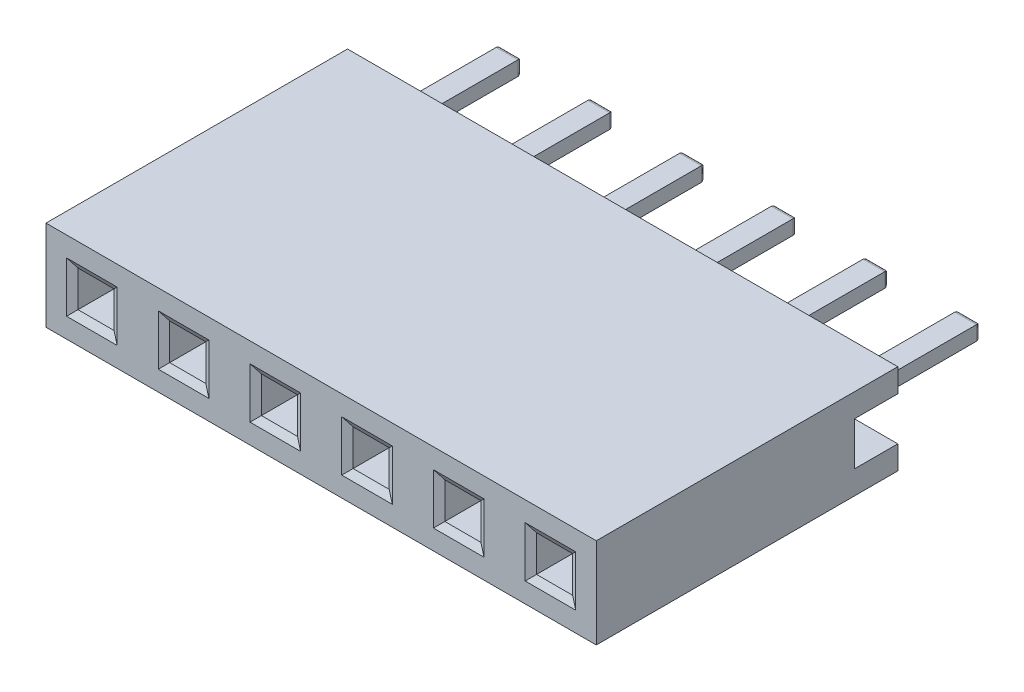
from build123d import *

# Parameters (mm, degrees)
SKETCH1_W                   = 2.54
SKETCH1_H                   = 2.5
SKETCH1_W_2                 = 1
SKETCH1_H_2                 = 1
BOSS_EXTRUDE1_DEPTH         = 8.35
CHAMFER1_SIZE               = 0.2
CHAMFER1_SIZE2              = 0.115470054
LPATTERN2_COUNT             = 6
LPATTERN2_PITCH             = 2.54
CHAMFER1_OF_LPATTERN2_SIZE2 = 0.115470054
CHAMFER1_OF_LPATTERN2_SIZE  = 0.2
SKETCH4_W                   = 1.2
SKETCH4_H                   = 1.2
CUT_EXTRUDE1_DEPTH          = 18.422473992
SKETCH3_W                   = 0.7
SKETCH3_H                   = 0.4
SKETCH3_W_2                 = 0.6
BOSS_EXTRUDE2_DEPTH         = 0.2
SKETCH3_3_W                 = 0.6
SKETCH3_3_H                 = 0.4
BOSS_EXTRUDE3_DEPTH         = 4.45
FILLET1_R                   = 0.1
FILLET2_R                   = 0.25
LPATTERN3_START             = -0.2
LPATTERN3_DEPTH             = 0.4
LPATTERN3_START_2           = -1
LPATTERN3_2_DEPTH           = 12


with BuildPart() as part:
    # Sketch1 → Boss-Extrude1 (new body)
    with BuildSketch(Plane.XY):
        with Locations((0.02, 0)):
            Rectangle(SKETCH1_W, SKETCH1_H)
        with Locations((0.02, 0)):
            Rectangle(SKETCH1_W_2, SKETCH1_H_2, mode=Mode.SUBTRACT)
    boss_extrude1 = extrude(amount=BOSS_EXTRUDE1_DEPTH)

    # Chamfer1
    chamfer1_edges = [part.edges().sort_by_distance(p)[0] for p in [
        (-0.48, 0, 8.35),
        (0.02, -0.5, 8.35),
        (0.52, 0, 8.35),
        (0.02, 0.5, 8.35),
    ]]
    chamfer1_side = [part.faces().sort_by_distance(p)[0] for p in [
        (0.02, -1.214360696, 8.35),
    ]]
    chamfer(chamfer1_edges, length=CHAMFER1_SIZE, length2=CHAMFER1_SIZE2, reference=chamfer1_side[0])

    # LPattern2: Boss-Extrude1 ×6
    with Locations(*[(i * LPATTERN2_PITCH, 0, 0) for i in range(1, LPATTERN2_COUNT)]):
        add(boss_extrude1)

    # Chamfer1 of LPattern2
    chamfer1_of_lpattern2_edges = [part.edges().sort_by_distance(p)[0] for p in [
        (2.06, 0, 8.35),
        (2.56, -0.5, 8.35),
        (3.06, 0, 8.35),
        (2.56, 0.5, 8.35),
        (4.6, 0, 8.35),
        (5.1, -0.5, 8.35),
        (5.6, 0, 8.35),
        (5.1, 0.5, 8.35),
        (7.14, 0, 8.35),
        (7.64, -0.5, 8.35),
        (8.14, 0, 8.35),
        (7.64, 0.5, 8.35),
        (9.68, 0, 8.35),
        (10.18, -0.5, 8.35),
        (10.68, 0, 8.35),
        (10.18, 0.5, 8.35),
        (12.22, 0, 8.35),
        (12.72, -0.5, 8.35),
        (13.22, 0, 8.35),
        (12.72, 0.5, 8.35),
    ]]
    chamfer(chamfer1_of_lpattern2_edges, length=CHAMFER1_OF_LPATTERN2_SIZE, length2=CHAMFER1_OF_LPATTERN2_SIZE2)

    # Sketch4 → Cut-Extrude1 (cut, through all)
    with BuildSketch(Plane.ZY.offset(1.25)):
        with Locations((0.6, 0)):
            Rectangle(SKETCH4_W, SKETCH4_H)
    extrude(amount=-CUT_EXTRUDE1_DEPTH, mode=Mode.SUBTRACT)

    # Sketch3 → Boss-Extrude2 (add)
    with BuildSketch(Plane(origin=(0, 0, 1.2), x_dir=(-1, 0, 0), z_dir=(0, 0, -1))):
        with Locations((-13.37, 0)):
            Rectangle(SKETCH3_W, SKETCH3_H)
        with Locations((-12.07, 0)):
            Rectangle(SKETCH3_W, SKETCH3_H)
        with Locations((-12.72, 0)):
            Rectangle(SKETCH3_W_2, SKETCH3_H)
    extrude(amount=BOSS_EXTRUDE2_DEPTH)

    # Sketch3<3> → Boss-Extrude3 (add)
    with BuildSketch(Plane(origin=(0, 0, 1.2), x_dir=(-1, 0, 0), z_dir=(0, 0, -1))):
        with Locations((-12.72, 0)):
            Rectangle(SKETCH3_3_W, SKETCH3_3_H)
    extrude(amount=BOSS_EXTRUDE3_DEPTH)

    # Fillet1
    fillet1_edges = [part.edges().sort_by_distance(p)[0] for p in [
        (12.42, 0, -3.25),
        (12.72, -0.2, -3.25),
        (12.72, 0.2, -3.25),
        (13.02, 0, -3.25),
    ]]
    fillet(fillet1_edges, radius=FILLET1_R)

    # Fillet2
    # the kernel refuses this fillet: 0.25 mm, written as the material it adds along each edge
    with BuildSketch(Plane(origin=(13.02, -0.2, 1), x_dir=(0, 0, -1), z_dir=(0, 1, 0)), Plane(origin=(12.42, 0.2, 1), x_dir=(0, 0, -1), z_dir=(0, -1, 0))) as fillet2_piece_1:
        with BuildLine():
            CenterArc((FILLET2_R, -FILLET2_R), FILLET2_R, 90, 90)
            Line((0, -FILLET2_R), (0, 0))
            Line((0, 0), (FILLET2_R, 0))
        make_face()
    extrude(amount=0.4)
    # the kernel refuses this fillet: 0.25 mm, written as the material it takes off along each edge
    with BuildSketch(Plane(origin=(11.72, -0.812372436, 1), x_dir=(1, 0, 0), z_dir=(0, 1, 0))) as fillet2_2_piece_1_section:
        with BuildLine():
            CenterArc((0.244948974, -0.25), FILLET2_R, 90, 78.463040967)
            Line((0, -0.2), (0, 0))
            Line((0, 0), (0.244948974, 0))
        make_face()
    fillet2_2_piece_1 = extrude(amount=1.624744871, mode=Mode.PRIVATE)
    fillet2_2_piece_1 = split(fillet2_2_piece_1, bisect_by=Plane(origin=(11.72, -0.6, 1), z_dir=(0, 1, 0)), keep=Keep.TOP, mode=Mode.PRIVATE)
    fillet2_2_piece_1 = split(fillet2_2_piece_1, bisect_by=Plane(origin=(11.72, 0.6, 1), z_dir=(0, -1, 0)), keep=Keep.TOP, mode=Mode.PRIVATE)
    add(fillet2_2_piece_1, mode=Mode.SUBTRACT)
    with BuildSketch(Plane(origin=(13.72, 0.812372436, 1), x_dir=(-1, 0, 0), z_dir=(0, -1, 0))) as fillet2_2_piece_2_section:
        with BuildLine():
            CenterArc((0.244948974, -0.25), FILLET2_R, 90, 78.463040967)
            Line((0, -0.2), (0, 0))
            Line((0, 0), (0.244948974, 0))
        make_face()
    fillet2_2_piece_2 = extrude(amount=1.624744871, mode=Mode.PRIVATE)
    fillet2_2_piece_2 = split(fillet2_2_piece_2, bisect_by=Plane(origin=(13.72, -0.6, 1), z_dir=(0, 1, 0)), keep=Keep.TOP, mode=Mode.PRIVATE)
    fillet2_2_piece_2 = split(fillet2_2_piece_2, bisect_by=Plane(origin=(13.72, 0.6, 1), z_dir=(0, -1, 0)), keep=Keep.TOP, mode=Mode.PRIVATE)
    add(fillet2_2_piece_2, mode=Mode.SUBTRACT)

    # LPattern3: read off the stored shape, not the designer's step
    # LPattern3 outline → LPattern3 (add)
    with BuildSketch(Plane(origin=(0, 0, 0), x_dir=(1, 0, 0), z_dir=(0, 1, 0)).offset(LPATTERN3_START)):
        with BuildLine():
            ThreePointArc((9.424948974, -1), (9.266835091, -1.056350833), (9.18, -1.2))
            Line((9.18, -1.2), (11.18, -1.2))
            ThreePointArc((11.18, -1.2), (11.093164909, -1.056350833), (10.935051026, -1))
            Line((10.935051026, -1), (10.73, -1))
            ThreePointArc((10.73, -1), (10.553223305, -0.926776695), (10.48, -0.75))
            Line((10.48, -0.75), (10.48, 3.15))
            ThreePointArc((10.48, 3.15), (10.450710678, 3.220710678), (10.38, 3.25))
            Line((10.38, 3.25), (9.98, 3.25))
            ThreePointArc((9.98, 3.25), (9.909289322, 3.220710678), (9.88, 3.15))
            Line((9.88, 3.15), (9.88, -0.75))
            ThreePointArc((9.88, -0.75), (9.806776695, -0.926776695), (9.63, -1))
            Line((9.63, -1), (9.424948974, -1))
        make_face()
        with BuildLine():
            ThreePointArc((6.884948974, -1), (6.726835091, -1.056350833), (6.64, -1.2))
            Line((6.64, -1.2), (8.64, -1.2))
            ThreePointArc((8.64, -1.2), (8.553164909, -1.056350833), (8.395051026, -1))
            Line((8.395051026, -1), (8.19, -1))
            ThreePointArc((8.19, -1), (8.013223305, -0.926776695), (7.94, -0.75))
            Line((7.94, -0.75), (7.94, 3.15))
            ThreePointArc((7.94, 3.15), (7.910710678, 3.220710678), (7.84, 3.25))
            Line((7.84, 3.25), (7.44, 3.25))
            ThreePointArc((7.44, 3.25), (7.369289322, 3.220710678), (7.34, 3.15))
            Line((7.34, 3.15), (7.34, -0.75))
            ThreePointArc((7.34, -0.75), (7.266776695, -0.926776695), (7.09, -1))
            Line((7.09, -1), (6.884948974, -1))
        make_face()
        with BuildLine():
            ThreePointArc((4.344948974, -1), (4.186835091, -1.056350833), (4.1, -1.2))
            Line((4.1, -1.2), (6.1, -1.2))
            ThreePointArc((6.1, -1.2), (6.013164909, -1.056350833), (5.855051026, -1))
            Line((5.855051026, -1), (5.65, -1))
            ThreePointArc((5.65, -1), (5.473223305, -0.926776695), (5.4, -0.75))
            Line((5.4, -0.75), (5.4, 3.15))
            ThreePointArc((5.4, 3.15), (5.370710678, 3.220710678), (5.3, 3.25))
            Line((5.3, 3.25), (4.9, 3.25))
            ThreePointArc((4.9, 3.25), (4.829289322, 3.220710678), (4.8, 3.15))
            Line((4.8, 3.15), (4.8, -0.75))
            ThreePointArc((4.8, -0.75), (4.726776695, -0.926776695), (4.55, -1))
            Line((4.55, -1), (4.344948974, -1))
        make_face()
        with BuildLine():
            ThreePointArc((1.804948974, -1), (1.646835091, -1.056350833), (1.56, -1.2))
            Line((1.56, -1.2), (3.56, -1.2))
            ThreePointArc((3.56, -1.2), (3.473164909, -1.056350833), (3.315051026, -1))
            Line((3.315051026, -1), (3.11, -1))
            ThreePointArc((3.11, -1), (2.933223305, -0.926776695), (2.86, -0.75))
            Line((2.86, -0.75), (2.86, 3.15))
            ThreePointArc((2.86, 3.15), (2.830710678, 3.220710678), (2.76, 3.25))
            Line((2.76, 3.25), (2.36, 3.25))
            ThreePointArc((2.36, 3.25), (2.289289322, 3.220710678), (2.26, 3.15))
            Line((2.26, 3.15), (2.26, -0.75))
            ThreePointArc((2.26, -0.75), (2.186776695, -0.926776695), (2.01, -1))
            Line((2.01, -1), (1.804948974, -1))
        make_face()
        with BuildLine():
            Line((0.775051026, -1), (0.57, -1))
            ThreePointArc((0.57, -1), (0.393223305, -0.926776695), (0.32, -0.75))
            Line((0.32, -0.75), (0.32, 3.15))
            ThreePointArc((0.32, 3.15), (0.290710678, 3.220710678), (0.22, 3.25))
            Line((0.22, 3.25), (-0.18, 3.25))
            ThreePointArc((-0.18, 3.25), (-0.250710678, 3.220710678), (-0.28, 3.15))
            Line((-0.28, 3.15), (-0.28, -0.75))
            ThreePointArc((-0.28, -0.75), (-0.353223305, -0.926776695), (-0.53, -1))
            Line((-0.53, -1), (-0.735051026, -1))
            ThreePointArc((-0.735051026, -1), (-0.893164909, -1.056350833), (-0.98, -1.2))
            Line((-0.98, -1.2), (1.02, -1.2))
            ThreePointArc((1.02, -1.2), (0.933164909, -1.056350833), (0.775051026, -1))
        make_face()
    extrude(amount=LPATTERN3_DEPTH)

    # LPattern3 2 outline → LPattern3 2 (cut)
    with BuildSketch(Plane.YZ.offset(LPATTERN3_START_2)):
        with BuildLine():
            Line((0.2, -3.25), (0.2, -3.15))
            ThreePointArc((0.2, -3.15), (0.170710678, -3.220710678), (0.1, -3.25))
            Line((0.1, -3.25), (0.2, -3.25))
        make_face()
        with BuildLine():
            Line((-0.2, -3.25), (-0.1, -3.25))
            ThreePointArc((-0.1, -3.25), (-0.170710678, -3.220710678), (-0.2, -3.15))
            Line((-0.2, -3.15), (-0.2, -3.25))
        make_face()
    extrude(amount=LPATTERN3_2_DEPTH, mode=Mode.SUBTRACT)


solid = part.part
